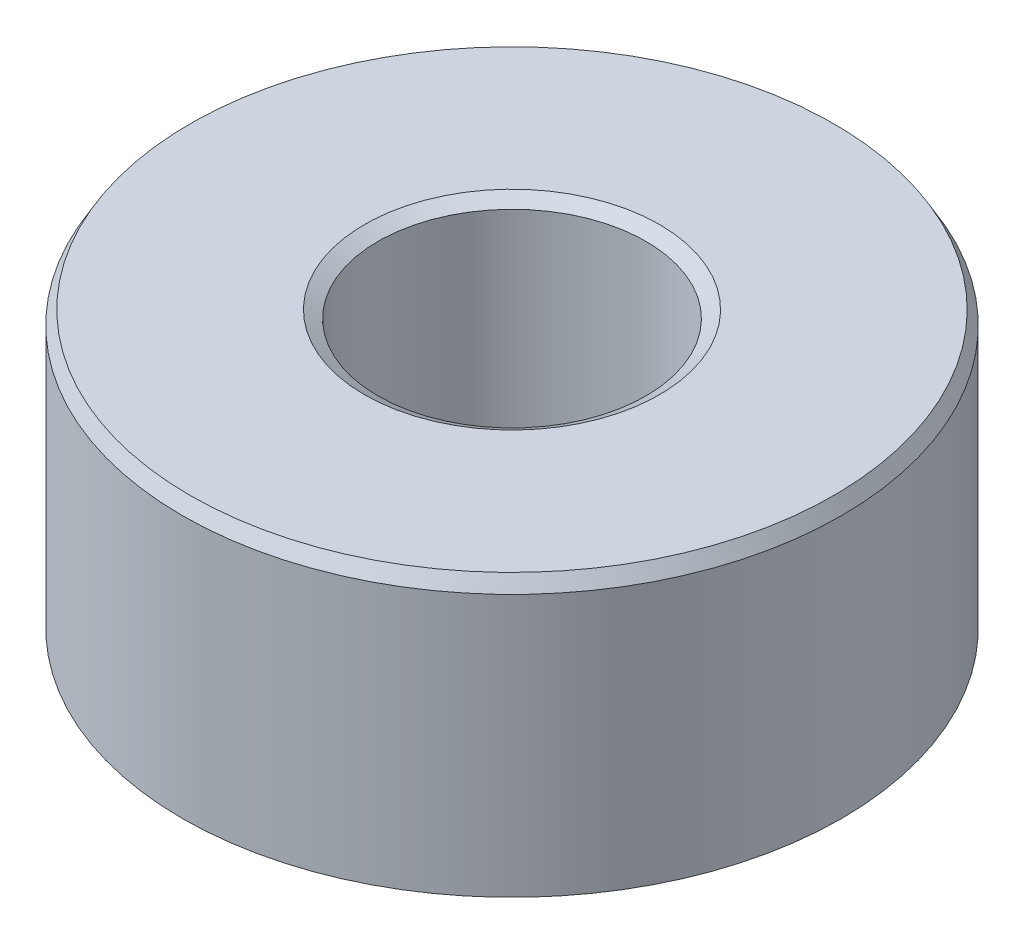
from build123d import *
from OCP.BRepFilletAPI import BRepFilletAPI_MakeChamfer

# Parameters (mm, degrees)
SKETCH1_R           = 60
BOSS_EXTRUDE1_DEPTH = 51.624645564
SKETCH2_R           = 24.378105365
CUT_EXTRUDE1_DEPTH  = 100.32323006
CHAMFER1_SIZE       = 2.463194037
CHAMFER1_SIZE2      = 1.42212574


with BuildPart() as part:
    # Sketch1 → Boss-Extrude1 (new body)
    with BuildSketch(Plane(origin=(0, 0, 0), x_dir=(1, 0, 0), z_dir=(0, 1, 0))):
        Circle(SKETCH1_R)
    extrude(amount=BOSS_EXTRUDE1_DEPTH)

    # Sketch2 → Cut-Extrude1 (cut, through all)
    with BuildSketch(Plane(origin=(0, 0, 0), x_dir=(1, 0, 0), z_dir=(0, 1, 0))):
        Circle(SKETCH2_R)
    extrude(amount=CUT_EXTRUDE1_DEPTH, mode=Mode.SUBTRACT)

    # Chamfer1: one chamfer whose edges measure the first distance from different faces: ONE call of the kernel's chamfer builder (chamfer() names one face for all edges)
    chamfer1_edges_1 = [part.edges().sort_by_distance(p)[0] for p in [
        (-24.378105365, 51.624645564, 0),
    ]]
    chamfer1_side_1 = [part.faces().sort_by_distance(p)[0] for p in [
        (-58.302943725, 51.624645564, 0),
    ]]
    chamfer1_edges_2 = [part.edges().sort_by_distance(p)[0] for p in [
        (-24.378105365, 0, 0),
    ]]
    chamfer1_side_2 = [part.faces().sort_by_distance(p)[0] for p in [
        (-24.378105365, 25.812322782, 0),
    ]]
    chamfer1_edges_3 = [part.edges().sort_by_distance(p)[0] for p in [
        (-60, 0, 0),
    ]]
    chamfer1_side_3 = [part.faces().sort_by_distance(p)[0] for p in [
        (-58.302943725, 0, 0),
    ]]
    chamfer1_edges_4 = [part.edges().sort_by_distance(p)[0] for p in [
        (-60, 51.624645564, 0),
    ]]
    chamfer1_side_4 = [part.faces().sort_by_distance(p)[0] for p in [
        (-60, 25.812322782, 0),
    ]]
    chamfer1 = BRepFilletAPI_MakeChamfer(part.part.solid().wrapped)
    for e in chamfer1_edges_1:
        chamfer1.Add(CHAMFER1_SIZE, CHAMFER1_SIZE2, e.wrapped, chamfer1_side_1[0].wrapped)  # the first distance lies on this face
    for e in chamfer1_edges_2:
        chamfer1.Add(CHAMFER1_SIZE, CHAMFER1_SIZE2, e.wrapped, chamfer1_side_2[0].wrapped)  # the first distance lies on this face
    for e in chamfer1_edges_3:
        chamfer1.Add(CHAMFER1_SIZE, CHAMFER1_SIZE2, e.wrapped, chamfer1_side_3[0].wrapped)  # the first distance lies on this face
    for e in chamfer1_edges_4:
        chamfer1.Add(CHAMFER1_SIZE, CHAMFER1_SIZE2, e.wrapped, chamfer1_side_4[0].wrapped)  # the first distance lies on this face
    add(Compound.cast(chamfer1.Shape()), mode=Mode.REPLACE)


solid = part.part
